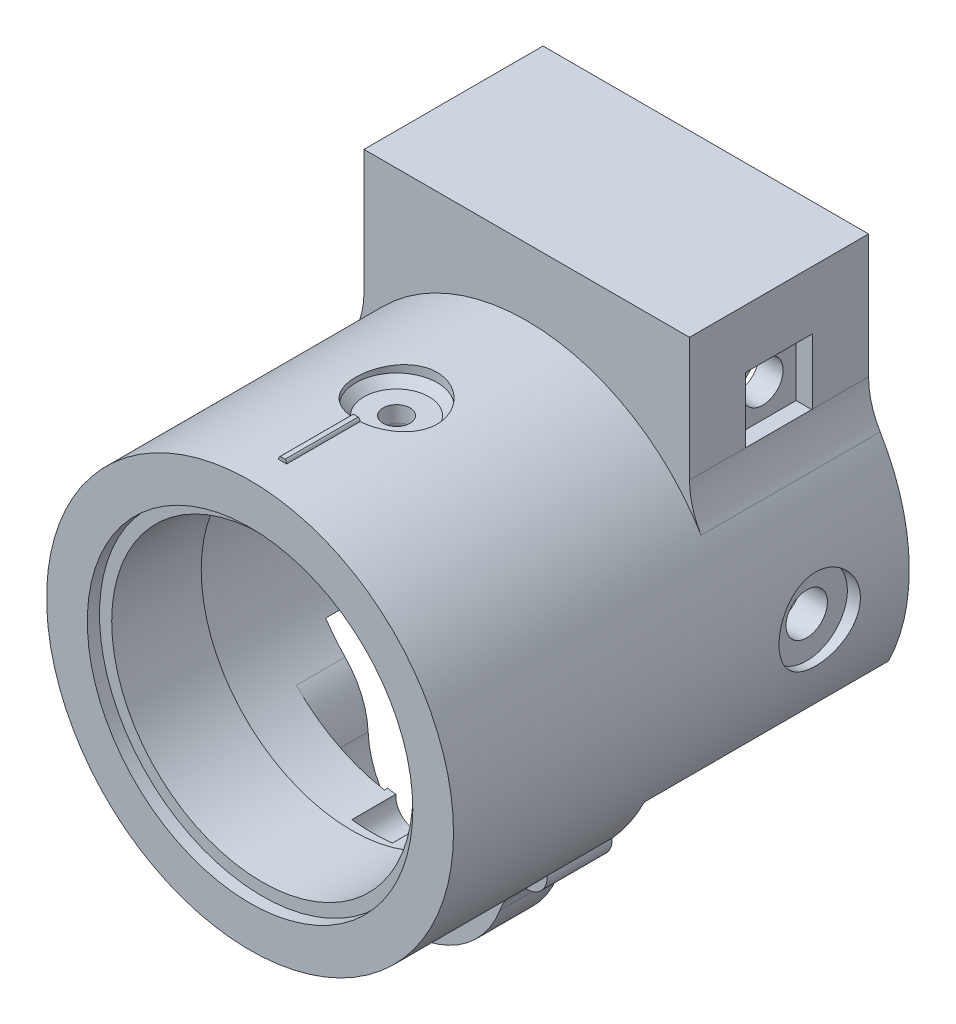
from build123d import *
from build123d.topology import SkipClean

# Parameters (mm, degrees)
SKETCH_1_R                = 25
SKETCH_1_R_2              = 18.5
EXTRUDE_1_DEPTH           = 11
SKETCH_2_R                = 25
SKETCH_2_R_2              = 20
EXTRUDE_2_DEPTH           = 1.5
EXTRUDE_START             = 1.5
SKETCH_3_R                = 25
SKETCH_3_R_2              = 20
EXTRUDE_3_DEPTH           = 1.5
SKETCH_4_R                = 0.5
EXTRUDE_4_DEPTH           = 10
EXTRUDE_START_2           = 4
SKETCH_6_R                = 22
EXTRUDE_5_DEPTH           = 4
SKETCH_7_R                = 2
CUT_EXTRUDE_1_DEPTH       = 4
F_1_ENCODERHOLDER_2_R     = 22
F_1_ENCODERHOLDER_2_R_2   = 18.5
F_1_ENCODERHOLDER_DEPTH   = 4
F_2_ENCODERHOLDER_START   = -4
F_2_ENCODERHOLDER_2_R     = 2
F_2_ENCODERHOLDER_DEPTH   = 4
F_3_ENCODERHOLDER_2_R     = 25
F_3_ENCODERHOLDER_2_R_2   = 18.5
F_3_ENCODERHOLDER_DEPTH   = 4
F_8_ENCODERHOLDER_R       = 2.5
CUT_EXTRUDE_6_DEPTH       = 10
SKETCH_9_R                = 12.5
CUT_EXTRUDE_7_DEPTH       = 2
F_5_ENCODERHOLDER_DEPTH   = 4
EXTRUDE_1_2_DEPTH         = 0.4
FILLET_1_R                = 1
SKETCH_12_R               = 0.9
CUT_EXTRUDE_8_DEPTH       = 10
EXTRUDE_2_2_DEPTH         = 6
FILLET_2_R                = 1
FILLET_START              = -1
FILLET_3_DEPTH            = 5
FILLET_START_2            = 0.675968
FILLET_3_2_DEPTH          = 5.324032
CUT_EXTRUDE_9_DEPTH       = 10
MOVE_BODY_2_ANGLE         = 180
SKETCH_15_R               = 20
CUT_EXTRUDE_10_DEPTH      = 79
EXTRUDE_12_DEPTH          = 4
CUT_EXTRUDE_11_DEPTH      = 3
EXTRUDE_13_DEPTH          = 10
EXTRUDE_14_DEPTH          = 1
SKETCH_22_R               = 1
CUT_EXTRUDE_12_DEPTH      = 8
SKETCH_23_R               = 2.5
SKETCH_23_R_2             = 1
EXTRUDE_16_DEPTH          = 8
SKETCH_24_W               = 1.265565874
SKETCH_24_H               = 0.2
CUT_EXTRUDE_13_DEPTH      = 25
EXTRUDE_5_2_DEPTH         = 6
FILLET_4_R                = 10
FILLET_5_R                = 10
FILLET_6_R                = 10
FILLET_7_R                = 10
SKETCH_26_R               = 1.65
CUT_EXTRUDE_14_DEPTH      = 36
SKETCH_27_R               = 5
CUT_EXTRUDE_15_DEPTH      = 2.5
FILLET_8_R                = 1
CHAMFER_2_SIZE            = 1
EXTRUDE_18_DEPTH          = 30
SKETCH_29_R               = 2.55
CUT_EXTRUDE_16_DEPTH      = 67
SKETCH_30_R               = 5
CUT_EXTRUDE_17_DEPTH      = 1
PATTERN_CIRCULAR_1_COUNT  = 4
SKETCH_31_W               = 30
SKETCH_31_H               = 29.165943348
CUT_EXTRUDE_18_DEPTH      = 20
SKETCH_32_W               = 5
SKETCH_32_H               = 20
EXTRUDE_19_DEPTH          = 20
SKETCH_33_W               = 40
SKETCH_33_H               = 20
EXTRUDE_20_DEPTH          = 3
EXTRUDE_21_DEPTH          = 2
SKETCH_36_R               = 2.5
CUT_EXTRUDE_19_DEPTH      = 82
FILLET_9_R                = 10
FILLET_10_R               = 10
SKETCH_37_W               = 8.2
SKETCH_37_H               = 8.1
CUT_EXTRUDE_20_DEPTH      = 2
CUT_EXTRUDE_21_DEPTH      = 2
CUT_EXTRUDE_21_DEPTH_BACK = 2
SKETCH_38_W               = 8.2
SKETCH_38_H               = 8.2
SKETCH_39_R               = 5
CUT_EXTRUDE_22_DEPTH      = 1
CUT_EXTRUDE_23_DEPTH      = 10
CUT_EXTRUDE_23_DEPTH_BACK = 1
SKETCH_40_R               = 5
FILLET_11_R               = 1


with BuildPart() as part:
    # 草图1 → Extrude 1 (new body)
    with BuildSketch(Plane.XY):
        Circle(SKETCH_1_R)
        Circle(SKETCH_1_R_2, mode=Mode.SUBTRACT)
    extrude(amount=EXTRUDE_1_DEPTH)

    # 草图2 → Extrude 2 (add)
    with BuildSketch(Plane.XY.offset(11)):
        Circle(SKETCH_2_R)
        Circle(SKETCH_2_R_2, mode=Mode.SUBTRACT)
    extrude(amount=EXTRUDE_2_DEPTH)

    # 草图3 → 凸台-拉伸3 (add)
    with BuildSketch(Plane(origin=(0, 0, 0), x_dir=(-1, 0, 0), z_dir=(0, 0, -1)).offset(EXTRUDE_START)):
        Circle(SKETCH_3_R)
        with Locations(Location((0, 0, 0), (0, 0, 180))):
            Circle(SKETCH_3_R_2, mode=Mode.SUBTRACT)
    extrude(amount=-EXTRUDE_3_DEPTH)

    # 草图4 → 凸台-拉伸4 (add)
    with SkipClean():  # the faces are left unmerged after this step: merging them gives an invalid solid
        with BuildSketch(Plane(origin=(0, 0, -1.5), x_dir=(-1, 0, 0), z_dir=(0, 0, -1))):
            with Locations((0, 25)):
                Circle(SKETCH_4_R)
        extrude(amount=-EXTRUDE_4_DEPTH)

    # 草图6 → Extrude 5 (add)
    with SkipClean():  # the faces are left unmerged after this step: merging them gives an invalid solid
        with BuildSketch(Plane(origin=(0, 0, -1.5), x_dir=(-1, 0, 0), z_dir=(0, 0, -1)).offset(EXTRUDE_START_2)):
            with BuildLine():
                ThreePointArc((-0.499974999, 24.995), (0, -25), (0.499974999, 24.995))
                ThreePointArc((0.499974999, 24.995), (0, 25.5), (-0.499974999, 24.995))
            make_face()
            Circle(SKETCH_6_R, mode=Mode.SUBTRACT)
        extrude(amount=-EXTRUDE_5_DEPTH)

    # 草图7 → 切除-拉伸1 (cut)
    with SkipClean():  # the faces are left unmerged after this step: merging them gives an invalid solid
        with BuildSketch(Plane(origin=(0, 0, -5.5), x_dir=(-1, 0, 0), z_dir=(0, 0, -1))):
            with Locations((0, 22)):
                Circle(SKETCH_7_R)
        extrude(amount=-CUT_EXTRUDE_1_DEPTH, mode=Mode.SUBTRACT)


with BuildPart() as body_2:
    # 1_EncoderHolder 2 → 1_EncoderHolder (new body)
    with BuildSketch(Plane.XY):
        Circle(F_1_ENCODERHOLDER_2_R)
        Circle(F_1_ENCODERHOLDER_2_R_2, mode=Mode.SUBTRACT)
    extrude(amount=F_1_ENCODERHOLDER_DEPTH)

    # 2_EncoderHolder 2 → 2_EncoderHolder (add)
    with BuildSketch(Plane.XY.offset(4).offset(F_2_ENCODERHOLDER_START)):
        with Locations((0, 22)):
            Circle(F_2_ENCODERHOLDER_2_R)
    extrude(amount=F_2_ENCODERHOLDER_DEPTH)

    # 3_EncoderHolder 2 → 3_EncoderHolder (add)
    with BuildSketch(Plane.XY.offset(4)):
        with Locations(Location((0, 0, 0), (0, 0, 91.14593469))):
            Circle(F_3_ENCODERHOLDER_2_R)
        Circle(F_3_ENCODERHOLDER_2_R_2, mode=Mode.SUBTRACT)
    extrude(amount=F_3_ENCODERHOLDER_DEPTH)

    # 草图8_EncoderHolder → 切除-拉伸6 (cut)
    with BuildSketch(Plane(origin=(0, 0, 0), x_dir=(-1, 0, 0), z_dir=(0, 0, -1))):
        with Locations((0, -20)):
            Circle(F_8_ENCODERHOLDER_R)
    extrude(amount=-CUT_EXTRUDE_6_DEPTH, mode=Mode.SUBTRACT)

    # 草图9 → 切除-拉伸7 (cut)
    with BuildSketch(Plane.XY.offset(8)):
        with Locations((0, -20)):
            Circle(SKETCH_9_R)
    extrude(amount=-CUT_EXTRUDE_7_DEPTH, mode=Mode.SUBTRACT)

    # 草图10 → 5_EncoderHolder (add)
    with BuildSketch(Plane.XY.offset(8)):
        with BuildLine():
            ThreePointArc((-11.297234175, -14.65), (-12.35555427, -18.105196926), (-12.381272085, -21.71875))
            ThreePointArc((-12.381272085, -21.71875), (0, 25), (12.381272085, -21.71875))
            ThreePointArc((12.381272085, -21.71875), (12.35555427, -18.105196926), (11.297234175, -14.65))
            ThreePointArc((11.297234175, -14.65), (0, 18.5), (-11.297234175, -14.65))
        make_face()
    extrude(amount=F_5_ENCODERHOLDER_DEPTH)

    # 草图11 → Extrude 1 2 (add)
    with BuildSketch(Plane.XY.offset(6)):
        with BuildLine():
            ThreePointArc((-1.920937271, -18.4), (0, -22.5), (1.920937271, -18.4))
            Line((1.920937271, -18.4), (2.68931218, -17.76))
            ThreePointArc((2.68931218, -17.76), (0, -23.5), (-2.68931218, -17.76))
            Line((-2.68931218, -17.76), (-1.920937271, -18.4))
        make_face()
    extrude(amount=EXTRUDE_1_2_DEPTH)

    # 圆角1
    # the kernel refuses this fillet: 1 mm, written as the material it takes off along each edge
    with BuildSketch(Plane(origin=(2.68931218, -17.76, 6), x_dir=(-0.7683749084931953, -0.6399999999984951, 0), z_dir=(0, 0, 1))) as fillet_1_piece_1:
        with BuildLine():
            CenterArc((1.2, 0.979795897), FILLET_1_R, 156.926081935, 101.536959033)
            Line((0.28, 1.371714256), (0.2616, 1.379552623))
            ThreePointArc((0.2616, 1.379552623), (0.051118442, 0.704), (-0.02, 0))
            Line((-0.02, 0), (0, -0.02))
            ThreePointArc((0, -0.02), (0.5, -0.02), (0.996, -0.019595918))
            Line((0.996, -0.019595918), (1, 0))
        make_face()
    extrude(amount=3.9, mode=Mode.SUBTRACT)
    with BuildSketch(Plane(origin=(-2.68931218, -17.76, 6), x_dir=(0.7683749084932087, -0.6399999999984791, 0), z_dir=(0, 0, 1))) as fillet_1_piece_2:
        with BuildLine():
            CenterArc((1.2, -0.979795897), FILLET_1_R, 101.536959033, 101.536959033)
            Line((0.28, -1.371714256), (0.2616, -1.379552623))
            ThreePointArc((0.2616, -1.379552623), (0.051118442, -0.704), (-0.02, 0))
            Line((-0.02, 0), (0, 0.02))
            ThreePointArc((0, 0.02), (0.5, 0.02), (0.996, 0.019595918))
            Line((0.996, 0.019595918), (1, 0))
        make_face()
    extrude(amount=3.9, mode=Mode.SUBTRACT)

    # 草图12 → 切除-拉伸8 (cut)
    with BuildSketch(Plane.XY.offset(12)):
        with Locations((-17.320508076, -10)):
            Circle(SKETCH_12_R)
        with Locations((17.320508076, -10)):
            Circle(SKETCH_12_R)
    extrude(amount=-CUT_EXTRUDE_8_DEPTH, mode=Mode.SUBTRACT)

    # 草图13 → Extrude 2 2 (add)
    with BuildSketch(Plane(origin=(0, 0, 0), x_dir=(-1, 0, 0), z_dir=(0, 0, -1))):
        Polygon((0, 18.5), (-7.664854858, 8), (-8.472547166, 8.58960422), (-0.807692308, 19.08960422), align=None)
    extrude(amount=-EXTRUDE_2_2_DEPTH)

    # 圆角2
    fillet_2_edges = [body_2.edges().sort_by_distance(p)[0] for p in [
        (1.269951879, 18.45635994, 3),
    ]]
    fillet(fillet_2_edges, radius=FILLET_2_R)

    # 圆角3: read off the stored shape, not the designer's step
    # 圆角3 outline → 圆角3 (cut)
    with BuildSketch(Plane.XY.offset(FILLET_START)):
        with BuildLine():
            ThreePointArc((-3.232609366, -18.215384615), (-2.572131012, -18.65007493), (-2.433817862, -19.428571429))
            ThreePointArc((-2.433817862, -19.428571429), (-2.237289178, -18.884411754), (-1.920937271, -18.4))
            ThreePointArc((-1.920937271, -18.4), (-2.578426157, -18.319435541), (-3.232609366, -18.215384615))
        make_face()
        with BuildLine():
            ThreePointArc((-1.572207346, -21.94375), (-2.132936973, -21.304062832), (-2.446717755, -20.513392857))
            ThreePointArc((-2.446717755, -20.513392857), (-2.703266107, -21.410498238), (-3.588519374, -21.705357143))
            ThreePointArc((-3.588519374, -21.705357143), (-2.583114953, -21.847826371), (-1.572207346, -21.94375))
        make_face()
        with BuildLine():
            ThreePointArc((2.433817862, -19.428571429), (2.572131012, -18.65007493), (3.232609366, -18.215384615))
            ThreePointArc((3.232609366, -18.215384615), (2.578426157, -18.319435541), (1.920937271, -18.4))
            ThreePointArc((1.920937271, -18.4), (2.237289178, -18.884411754), (2.433817862, -19.428571429))
        make_face()
        with BuildLine():
            ThreePointArc((2.446717755, -20.513392857), (2.132936973, -21.304062832), (1.572207346, -21.94375))
            ThreePointArc((1.572207346, -21.94375), (2.583114953, -21.847826371), (3.588519374, -21.705357143))
            ThreePointArc((3.588519374, -21.705357143), (2.703266107, -21.410498238), (2.446717755, -20.513392857))
        make_face()
    extrude(amount=FILLET_3_DEPTH, mode=Mode.SUBTRACT)

    # Fillet 3 2 outline → Fillet 3 2 (cut)
    with BuildSketch(Plane.XY.offset(FILLET_START_2)):
        with BuildLine():
            ThreePointArc((-3.232609366, -18.215384615), (-2.572131012, -18.65007493), (-2.433817862, -19.428571429))
            ThreePointArc((-2.433817862, -19.428571429), (-2.237289178, -18.884411754), (-1.920937271, -18.4))
            ThreePointArc((-1.920937271, -18.4), (-2.578426157, -18.319435541), (-3.232609366, -18.215384615))
        make_face()
        with BuildLine():
            ThreePointArc((2.433817862, -19.428571429), (2.572131012, -18.65007493), (3.232609366, -18.215384615))
            ThreePointArc((3.232609366, -18.215384615), (2.578426157, -18.319435541), (1.920937271, -18.4))
            ThreePointArc((1.920937271, -18.4), (2.237289178, -18.884411754), (2.433817862, -19.428571429))
        make_face()
    extrude(amount=FILLET_3_2_DEPTH, mode=Mode.SUBTRACT)

    # 草图14 → 切除-拉伸9 (cut)
    with BuildSketch(Plane(origin=(0, 0, 6), x_dir=(-1, 0, 0), z_dir=(0, 0, -1))):
        with BuildLine():
            ThreePointArc((-1.920937271, -18.4), (-2.374439978, -18.281048442), (-2.832315159, -18.38186757))
            ThreePointArc((-2.832315159, -18.38186757), (-2.472783917, -18.844197291), (-2.433817862, -19.428571429))
            ThreePointArc((-2.433817862, -19.428571429), (-2.237289178, -18.884411754), (-1.920937271, -18.4))
        make_face()
        with BuildLine():
            ThreePointArc((2.832315159, -18.38186757), (2.374439978, -18.281048442), (1.920937271, -18.4))
            ThreePointArc((1.920937271, -18.4), (2.237289178, -18.884411754), (2.433817862, -19.428571429))
            ThreePointArc((2.433817862, -19.428571429), (2.472783917, -18.844197291), (2.832315159, -18.38186757))
        make_face()
    extrude(amount=-CUT_EXTRUDE_9_DEPTH, mode=Mode.SUBTRACT)


with BuildPart() as body_2_1:
    # Move Body 1: moved
    add(body_2.part.moved(Location((-19.686751507, 39.513113702, 20.464284415))))


with BuildPart() as body_2_2:
    # Move Body 2: read off the stored shape, not the designer's step
    # Move Body 2: moved
    add(body_2_1.part.moved(Location((19.6867515, -39.5131137, -18.9642844))).rotate(Axis((0, 0, 0), (0, 1, 0)), MOVE_BODY_2_ANGLE))

    # Combine 1: union part
    add(part.part)

    # 草图15 → 切除-拉伸10 (cut)
    with BuildSketch(Plane(origin=(0, 0, 0), x_dir=(-1, 0, 0), z_dir=(0, 0, -1))):
        with Locations(Location((0, 0, 0), (0, 0, 180))):
            Circle(SKETCH_15_R)
    extrude(amount=CUT_EXTRUDE_10_DEPTH, mode=Mode.SUBTRACT)

    # 草图16 → 凸台-拉伸12 (add)
    with BuildSketch(Plane(origin=(0, 0, -1.5), x_dir=(-1, 0, 0), z_dir=(0, 0, -1))):
        with BuildLine():
            ThreePointArc((-2.49511241, -19.84375), (-2.493496889, -20.180203401), (-2.446717755, -20.513392857))
            ThreePointArc((-2.446717755, -20.513392857), (-2.703266107, -21.410498238), (-3.588519374, -21.705357143))
            ThreePointArc((-3.588519374, -21.705357143), (0, -22), (3.588519374, -21.705357143))
            ThreePointArc((3.588519374, -21.705357143), (2.703266107, -21.410498238), (2.446717755, -20.513392857))
            ThreePointArc((2.446717755, -20.513392857), (2.493496889, -20.180203401), (2.49511241, -19.84375))
            ThreePointArc((2.49511241, -19.84375), (0, -20), (-2.49511241, -19.84375))
        make_face()
    extrude(amount=EXTRUDE_12_DEPTH)

    # 草图17 → 切除-拉伸11 (cut)
    with BuildSketch(Plane(origin=(0, 0, -5.5), x_dir=(-1, 0, 0), z_dir=(0, 0, -1))):
        with BuildLine():
            ThreePointArc((-2.49511241, -19.84375), (0, -22.5), (2.49511241, -19.84375))
            ThreePointArc((2.49511241, -19.84375), (0, -20), (-2.49511241, -19.84375))
        make_face()
    extrude(amount=-CUT_EXTRUDE_11_DEPTH, mode=Mode.SUBTRACT)

    # 草图19 → 凸台-拉伸13 (add)
    with BuildSketch(Plane(origin=(0, 0, -3.5), x_dir=(-1, 0, 0), z_dir=(0, 0, -1))):
        with BuildLine():
            ThreePointArc((16.853084982, -10.769100547), (18.099930939, -10.45), (17.752857141, -9.210649453))
            ThreePointArc((17.752857141, -9.210649453), (17.320508076, -10), (16.853084982, -10.769100547))
        make_face()
        with BuildLine():
            ThreePointArc((-17.752857141, -9.210649453), (-18.099930939, -10.45), (-16.853084982, -10.769100547))
            ThreePointArc((-16.853084982, -10.769100547), (-17.320508076, -10), (-17.752857141, -9.210649453))
        make_face()
    extrude(amount=EXTRUDE_13_DEPTH)

    # 草图20 → 凸台-拉伸14 (add)
    with BuildSketch(Plane(origin=(0, 0, -7.5), x_dir=(-1, 0, 0), z_dir=(0, 0, -1))):
        with BuildLine():
            ThreePointArc((-12.381272085, -21.71875), (0, -32.5), (12.381272085, -21.71875))
            ThreePointArc((12.381272085, -21.71875), (0, -25), (-12.381272085, -21.71875))
        make_face()
    extrude(amount=-EXTRUDE_14_DEPTH)

    # 草图22 → 切除-拉伸12 (cut)
    with BuildSketch(Plane(origin=(0, 0, -13.5), x_dir=(-1, 0, 0), z_dir=(0, 0, -1))):
        with Locations((-16, -17)):
            Circle(SKETCH_22_R)
    cut_extrude_12 = extrude(amount=-CUT_EXTRUDE_12_DEPTH, mode=Mode.SUBTRACT)

    # 草图23 → 凸台-拉伸16 (add)
    with BuildSketch(Plane(origin=(0, 0, -13.5), x_dir=(-1, 0, 0), z_dir=(0, 0, -1))):
        with Locations((-16, -17)):
            Circle(SKETCH_23_R)
        with Locations((-16, -17)):
            Circle(SKETCH_23_R_2, mode=Mode.SUBTRACT)
    extrude_16 = extrude(amount=-EXTRUDE_16_DEPTH)

    # 镜向2: 切除-拉伸12, 凸台-拉伸16 across plane
    add(cut_extrude_12.mirror(Plane(origin=(0, 0, 0), x_dir=(0, 0, 1), z_dir=(1, 0, 0))), mode=Mode.SUBTRACT)
    add(extrude_16.mirror(Plane(origin=(0, 0, 0), x_dir=(0, 0, 1), z_dir=(1, 0, 0))))

    # 草图24 → 切除-拉伸13 (cut)
    with BuildSketch(Plane(origin=(0, 0, -13.5), x_dir=(-1, 0, 0), z_dir=(0, 0, -1))):
        with Locations((0, 25.5)):
            Rectangle(SKETCH_24_W, SKETCH_24_H)
    extrude(amount=-CUT_EXTRUDE_13_DEPTH, mode=Mode.SUBTRACT)

    # 草图25 → Extrude 5 2 (add)
    with BuildSketch(Plane(origin=(0, 0, -7.5), x_dir=(-1, 0, 0), z_dir=(0, 0, -1))):
        with BuildLine():
            ThreePointArc((-11.873971995, -16.09375), (-12.449472784, -18.877223349), (-12.381272085, -21.71875))
            ThreePointArc((-12.381272085, -21.71875), (0, -32.5), (12.381272085, -21.71875))
            ThreePointArc((12.381272085, -21.71875), (12.449472784, -18.877223349), (11.873971995, -16.09375))
            Line((11.873971995, -16.09375), (10.924054235, -16.40625))
            ThreePointArc((10.924054235, -16.40625), (11.453514961, -18.967045481), (11.390770318, -21.58125))
            ThreePointArc((11.390770318, -21.58125), (0, -31.5), (-11.390770318, -21.58125))
            ThreePointArc((-11.390770318, -21.58125), (-11.453514961, -18.967045481), (-10.924054235, -16.40625))
            Line((-10.924054235, -16.40625), (-11.873971995, -16.09375))
        make_face()
    extrude(amount=EXTRUDE_5_2_DEPTH)

    # 圆角4
    # the kernel refuses this fillet: 10 mm, written as the material it takes off along each edge
    with BuildSketch(Plane(origin=(10.924054235, -16.40625, -7.5), x_dir=(0.9499177588002072, 0.312500002425586, 0), z_dir=(0, 0, -1))) as fillet_4_piece_1:
        with BuildLine():
            CenterArc((9.239999982, 5.665898025), FILLET_4_R, 195.279631881, 19.233131139)
            ThreePointArc((-0.406511638, 3.030596604), (-0.102080978, 1.528869475), (0, 0))
            Line((0, 0), (1.000000008, 0))
        make_face()
    extrude(amount=13.644347377, mode=Mode.SUBTRACT)
    with BuildSketch(Plane(origin=(-10.924054235, -16.40625, -7.5), x_dir=(-0.9499177602580843, 0.31249999799402367, 0), z_dir=(0, 0, -1))) as fillet_4_piece_2:
        with BuildLine():
            CenterArc((9.240000015, -5.665897956), FILLET_4_R, 145.487237464, 19.233130995)
            ThreePointArc((-0.40651162, -3.030596592), (-0.10208097, -1.528869468), (0, 0))
            Line((0, 0), (0.999999994, 0))
        make_face()
    extrude(amount=13.64434734, mode=Mode.SUBTRACT)

    # 圆角5
    # the kernel refuses this fillet: 10 mm, written as the material it takes off along each edge
    with BuildSketch(Plane(origin=(-11.87397199, -16.093750004, -24.569552782), x_dir=(-0.7538894395280353, 0.6570013036274012, 0), z_dir=(0, 0, 1))) as fillet_5_piece_1:
        with BuildLine():
            CenterArc((4.054881612, 9.967061623), FILLET_5_R, 223.587400745, 41.760938805)
            Line((-3.18835329, 3.072458796), (-3.912676781, 2.382998513))
            ThreePointArc((-3.912676781, 2.382998513), (-3.259922176, 1.628489204), (-0.539147437, -0.842211399))
            Line((-0.539147437, -0.842211399), (0.081097632, -0.996706162))
            ThreePointArc((0.081097632, -0.996706162), (1.621952645, -0.934123247), (3.162807657, -0.996706162))
            Line((3.162807657, -0.996706162), (3.243905289, 0))
        make_face()
    extrude(amount=17.069552767, mode=Mode.SUBTRACT)

    # 圆角6
    # the kernel refuses this fillet: 10 mm, written as the material it takes off along each edge
    with BuildSketch(Plane(origin=(11.873972002, -16.093749995, -7.500000015), x_dir=(0.7538894392828103, 0.6570013039087899, 0), z_dir=(0, 0, -1))) as fillet_6_piece_1:
        with BuildLine():
            CenterArc((4.054881593, 9.967061624), FILLET_6_R, 223.587400767, 41.760938805)
            Line((-3.188353306, 3.072458793), (-3.912676796, 2.38299851))
            ThreePointArc((-3.912676796, 2.38299851), (-3.2599222, 1.628489213), (-0.539147434, -0.842211401))
            Line((-0.539147434, -0.842211401), (0.081097632, -0.996706162))
            ThreePointArc((0.081097632, -0.996706162), (1.621952637, -0.934123247), (3.162807643, -0.996706162))
            Line((3.162807643, -0.996706162), (3.243905275, 0))
        make_face()
    extrude(amount=17.069552792, mode=Mode.SUBTRACT)

    # 圆角7
    fillet_7_edges = [body_2_2.edges().sort_by_distance(p)[0] for p in [
        (-12.381272077, -21.718749998, -10.500000015),
        (12.38127209, -21.718749998, -10.500000011),
    ]]
    fillet(fillet_7_edges, radius=FILLET_7_R)

    # 草图26 → 切除-拉伸14 (cut)
    with BuildSketch(Plane(origin=(0, 0, 0), x_dir=(1, 0, 0), z_dir=(0, 1, 0))):
        with Locations(Location((0, 5.5, 0), (0, 0, 90))):
            Circle(SKETCH_26_R)
    extrude(amount=CUT_EXTRUDE_14_DEPTH, mode=Mode.SUBTRACT)

    # 草图27 → 切除-拉伸15 (cut)
    with BuildSketch(Plane(origin=(0, 25.4, 0), x_dir=(1, 0, 0), z_dir=(0, 1, 0))):
        with Locations(Location((0, 5.5, 0), (0, 0, 270))):
            Circle(SKETCH_27_R)
    extrude(amount=-CUT_EXTRUDE_15_DEPTH, mode=Mode.SUBTRACT)

    # 圆角8
    fillet_8_edges = [body_2_2.edges().sort_by_distance(p)[0] for p in [
        (-6e-09, 20.000000028, -3.84999999),
    ]]
    fillet(fillet_8_edges, radius=FILLET_8_R)

    # 倒角2
    chamfer_2_edges = [body_2_2.edges().sort_by_distance(p)[0] for p in [
        (0, 22.9, -10.5),
    ]]
    chamfer(chamfer_2_edges, length=CHAMFER_2_SIZE)

    # 草图28 → 凸台-拉伸18 (add)
    with BuildSketch(Plane(origin=(0, 0, -13.5), x_dir=(-1, 0, 0), z_dir=(0, 0, -1))):
        with BuildLine():
            Line((-22.449944321, -11), (-16.703293088, -11))
            ThreePointArc((-16.703293088, -11), (0, 20), (16.703293088, -11))
            Line((16.703293088, -11), (22.449944321, -11))
            ThreePointArc((22.449944321, -11), (0, 25), (-22.449944321, -11))
        make_face()
    extrude(amount=EXTRUDE_18_DEPTH)

    # 草图29 → 切除-拉伸16 (cut)
    with BuildSketch(Plane(origin=(0, 0, 0), x_dir=(1, 0, 0), z_dir=(0, 1, 0))):
        with Locations(Location((0, 32.5, 0), (0, 0, 90))):
            Circle(SKETCH_29_R)
    cut_extrude_16 = extrude(amount=CUT_EXTRUDE_16_DEPTH, mode=Mode.SUBTRACT)

    # 草图30 → 切除-拉伸17 (cut)
    with BuildSketch(Plane(origin=(0, 25.4, 0), x_dir=(1, 0, 0), z_dir=(0, 1, 0))):
        with Locations(Location((0, 32.5, 0), (0, 0, 270))):
            Circle(SKETCH_30_R)
    cut_extrude_17 = extrude(amount=-CUT_EXTRUDE_17_DEPTH, mode=Mode.SUBTRACT)

    # 阵列(圆周)1: 切除-拉伸16, 切除-拉伸17 ×4 about axis
    pattern_circular_1_axis = Axis((0, 0, 0), (0, 0, 1))
    add([cut_extrude_16.rotate(pattern_circular_1_axis, i * 360 / PATTERN_CIRCULAR_1_COUNT) for i in range(1, PATTERN_CIRCULAR_1_COUNT)], mode=Mode.SUBTRACT)
    add([cut_extrude_17.rotate(pattern_circular_1_axis, i * 360 / PATTERN_CIRCULAR_1_COUNT) for i in range(1, PATTERN_CIRCULAR_1_COUNT)], mode=Mode.SUBTRACT)

    # 草图31 → 切除-拉伸18 (cut)
    with BuildSketch(Plane(origin=(0, 0, -43.5), x_dir=(-1, 0, 0), z_dir=(0, 0, -1))):
        with Locations((0, 20)):
            Rectangle(SKETCH_31_W, SKETCH_31_H)
    extrude(amount=-CUT_EXTRUDE_18_DEPTH, mode=Mode.SUBTRACT)

    # 草图32 → 凸台-拉伸19 (add)
    with BuildSketch(Plane(origin=(0, 0, -43.5), x_dir=(-1, 0, 0), z_dir=(0, 0, -1))):
        with Locations((17.5, 23.228756555)):
            Rectangle(SKETCH_32_W, SKETCH_32_H)
    extrude_19 = extrude(amount=-EXTRUDE_19_DEPTH)

    # 镜向3: 凸台-拉伸19 across plane
    add(extrude_19.mirror(Plane(origin=(0, 0, 0), x_dir=(0, 0, 1), z_dir=(1, 0, 0))))

    # 草图33 → 凸台-拉伸20 (add)
    with BuildSketch(Plane(origin=(0, 33.228756555, 0), x_dir=(1, 0, 0), z_dir=(0, 1, 0))):
        with Locations((0, 33.5)):
            Rectangle(SKETCH_33_W, SKETCH_33_H)
    extrude(amount=-EXTRUDE_20_DEPTH)

    # 草图35 → 凸台-拉伸21 (add)
    with BuildSketch(Plane.XY.offset(-23.5)):
        with BuildLine():
            Line((20, 33.228756555), (-20, 33.228756555))
            Line((-20, 33.228756555), (-20, 15))
            ThreePointArc((-20, 15), (-17.67766953, 17.67766953), (-15, 20))
            Line((-15, 20), (-15, 30.228756555))
            Line((-15, 30.228756555), (15, 30.228756555))
            Line((15, 30.228756555), (15, 20))
            ThreePointArc((15, 20), (17.67766953, 17.67766953), (20, 15))
            Line((20, 15), (20, 33.228756555))
        make_face()
        with BuildLine():
            ThreePointArc((-15, 20), (0, 25), (15, 20))
            Line((15, 20), (15, 30.228756555))
            Line((15, 30.228756555), (-15, 30.228756555))
            Line((-15, 30.228756555), (-15, 20))
        make_face()
    extrude(amount=EXTRUDE_21_DEPTH)

    # 草图36 → 切除-拉伸19 (cut)
    with BuildSketch(Plane(origin=(20, 0, 0), x_dir=(0, 0, -1), z_dir=(1, 0, 0))):
        with Locations((32.5, 22)):
            Circle(SKETCH_36_R)
    extrude(amount=-CUT_EXTRUDE_19_DEPTH, mode=Mode.SUBTRACT)

    # 圆角9
    fillet_9_edges = [body_2_2.edges().sort_by_distance(p)[0] for p in [
        (-20, 15, -33.5),
        (20, 15, -33.5),
    ]]
    fillet(fillet_9_edges, radius=FILLET_9_R)

    # 圆角10
    fillet_10_edges = [body_2_2.edges().sort_by_distance(p)[0] for p in [
        (-15, 13.228756555, -33.5),
        (15, 13.228756555, -33.5),
    ]]
    fillet(fillet_10_edges, radius=FILLET_10_R)

    # 草图37 → 切除-拉伸20 (cut)
    with SkipClean():  # the faces are left unmerged after this step: merging them gives an invalid solid
        with BuildSketch(Plane(origin=(20, 0, 0), x_dir=(0, 0, -1), z_dir=(1, 0, 0))):
            with Locations((32.5, 22)):
                Rectangle(SKETCH_37_W, SKETCH_37_H)
        extrude(amount=-CUT_EXTRUDE_20_DEPTH, mode=Mode.SUBTRACT)

    # 草图38 → 切除-拉伸21 (cut, two sides: drawn at the far end of the back side and taken through both)
    with SkipClean():  # the faces are left unmerged after this step: merging them gives an invalid solid
        with BuildSketch(Plane.ZY.offset(24.4).offset(-CUT_EXTRUDE_21_DEPTH_BACK)):
            with Locations((-32.5, 0)):
                Rectangle(SKETCH_38_W, SKETCH_38_H)
        extrude(amount=CUT_EXTRUDE_21_DEPTH + CUT_EXTRUDE_21_DEPTH_BACK, mode=Mode.SUBTRACT)

    # 草图39 → 切除-拉伸22 (cut)
    with SkipClean():  # the faces are left unmerged after this step: merging them gives an invalid solid
        with BuildSketch(Plane(origin=(24.4, 0, 0), x_dir=(0, 0, -1), z_dir=(1, 0, 0))):
            with Locations(Location((32.5, 0, 0), (0, 0, 90))):
                Circle(SKETCH_39_R)
        extrude(amount=-CUT_EXTRUDE_22_DEPTH, mode=Mode.SUBTRACT)

    # 草图40 → 切除-拉伸23 (cut, two sides: drawn at the far end of the back side and taken through both)
    with SkipClean():  # the faces are left unmerged after this step: merging them gives an invalid solid
        with BuildSketch(Plane.ZY.offset(20).offset(-CUT_EXTRUDE_23_DEPTH_BACK)):
            with Locations(Location((-32.5, 22, 0), (0, 0, 232.603217262))):
                Circle(SKETCH_40_R)
        extrude(amount=CUT_EXTRUDE_23_DEPTH + CUT_EXTRUDE_23_DEPTH_BACK, mode=Mode.SUBTRACT)

    # 圆角11
    fillet_11_edges = [body_2_2.edges().sort_by_distance(p)[0] for p in [
        (-15, 19.5, -32.5),
    ]]
    fillet(fillet_11_edges, radius=FILLET_11_R)


solid = body_2_2.part
